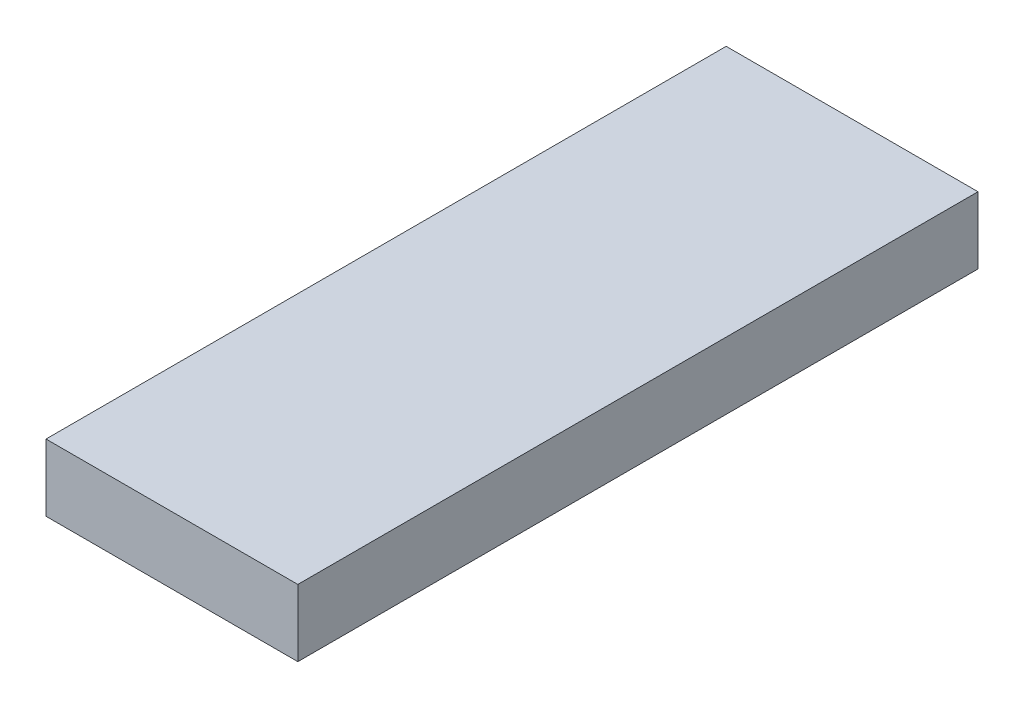
from build123d import *

# Parameters (mm, degrees)
SKETCH1_W           = 11.292329408
SKETCH1_H           = 3
BOSS_EXTRUDE1_DEPTH = 15.25


with BuildPart() as part:
    # Sketch1 → Boss-Extrude1 (new, symmetric)
    with BuildSketch(Plane.XY):
        with Locations((0, 55.219668759)):
            Rectangle(SKETCH1_W, SKETCH1_H)
    extrude(amount=BOSS_EXTRUDE1_DEPTH, both=True)


solid = part.part
